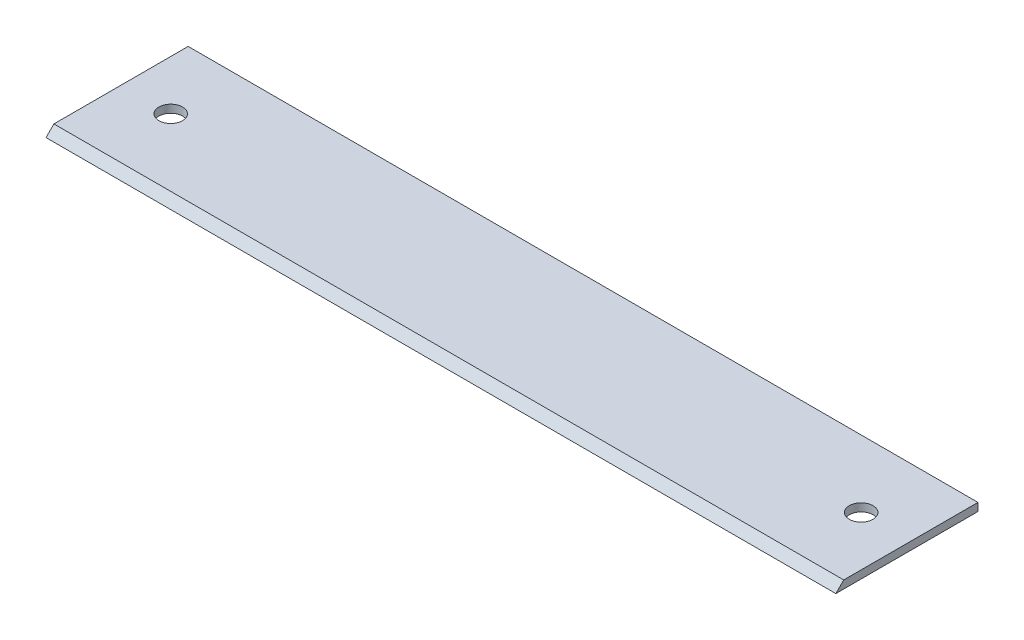
from build123d import *

# Parameters (mm, degrees)
SKETCH_1_W          = 100
SKETCH_1_H          = 18
EXTRUDE_1_DEPTH     = 1
CHAMFER_1_SIZE      = 1
SKETCH_3_R          = 1.5
CUT_EXTRUDE_2_DEPTH = 20


with BuildPart() as part:
    # Эскиз1 → Бобышка-Вытянуть1 (new body)
    with BuildSketch(Plane(origin=(0, 0, 0), x_dir=(1, 0, 0), z_dir=(0, 1, 0))):
        Rectangle(SKETCH_1_W, SKETCH_1_H)
    extrude(amount=EXTRUDE_1_DEPTH)

    # Фаска1
    chamfer_1_edges = [part.edges().sort_by_distance(p)[0] for p in [
        (0, 1, 9),
    ]]
    chamfer(chamfer_1_edges, length=CHAMFER_1_SIZE - 0.0001)  # a hair under: the kernel refuses the full size

    # Эскиз3 → Вырез-Вытянуть2 (cut)
    with BuildSketch(Plane(origin=(0, 1, 0), x_dir=(1, 0, 0), z_dir=(0, 1, 0))):
        with Locations(Location((-43.709679881, 0.5, 0), (0, 0, 270))):
            Circle(SKETCH_3_R)
        with Locations(Location((43.709679881, 0.5, 0), (0, 0, 90))):
            Circle(SKETCH_3_R)
    extrude(amount=-CUT_EXTRUDE_2_DEPTH, mode=Mode.SUBTRACT)


solid = part.part
